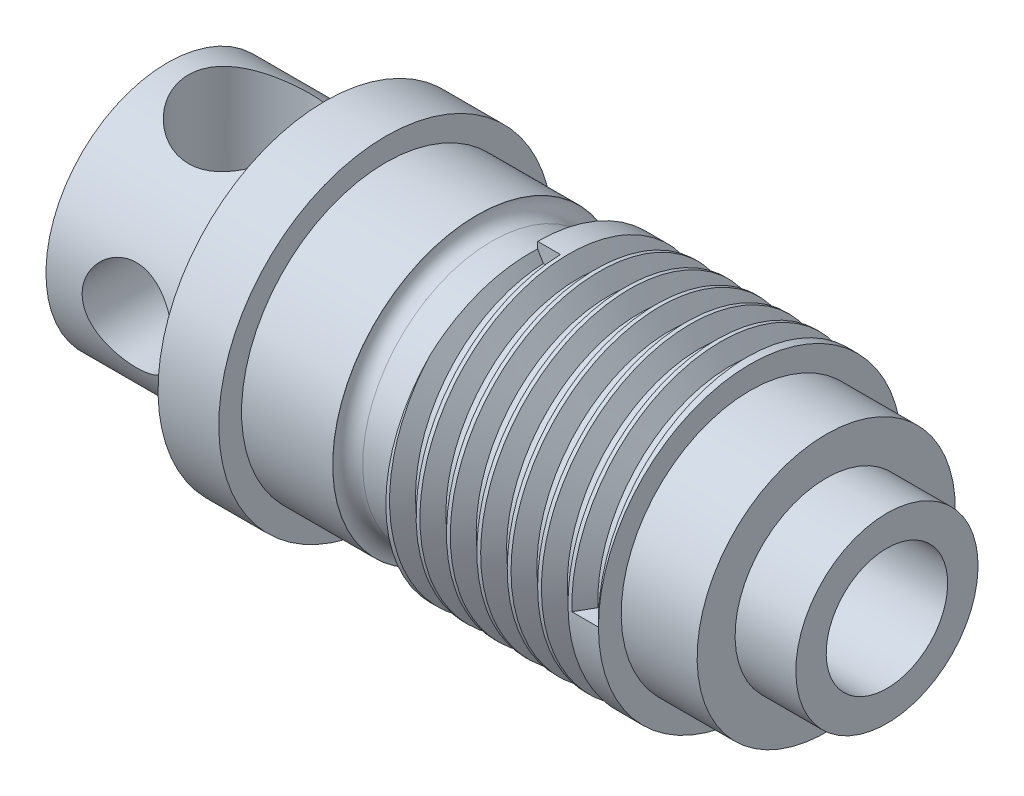
from build123d import *

# Parameters (mm, degrees)
CUT_EXTRUDE_1_DEPTH      = 16.149257408
CUT_EXTRUDE_1_DEPTH_BACK = 16.149257408
SKETCH_2_R               = 1.5
CUT_EXTRUDE_2_DEPTH      = 16.149257408
CUT_EXTRUDE_2_DEPTH_BACK = 16.149257408
SKETCH_3_R               = 2
THREAD_1_PITCH           = 1
SKETCH_6_R               = 2
CUT_EXTRUDE_3_DEPTH      = 21


with BuildPart() as part:
    # Sketch 1 → Повернуть1 (revolve)
    with BuildSketch(Plane.XY, mode=Mode.PRIVATE) as revolve_1_sk:
        with BuildLine():
            Line((13, 0), (-13, 0))
            Line((-13, 0), (-10.690598923, -4))
            Line((-10.690598923, -4), (-5.5, -4))
            Line((-5.5, -4), (-5.5, -5.5))
            Line((-5.5, -5.5), (-3.5, -5.5))
            Line((-3.5, -5.5), (-3.5, -4.75))
            Line((-3.5, -4.75), (-0.5, -4.75))
            Line((-0.5, -4.75), (-0.5, -4.74))
            ThreePointArc((-0.5, -4.74), (-0.356482323, -4.393517677), (-0.01, -4.25))
            Line((-0.01, -4.25), (1, -4.25))
            ThreePointArc((1, -4.25), (1.353553391, -4.396446609), (1.5, -4.75))
            Line((1.5, -4.75), (1.5, -5))
            Line((1.5, -5), (8.5, -5))
            Line((8.5, -5), (8.5, -4.25))
            Line((8.5, -4.25), (11, -4.25))
            Line((11, -4.25), (11, -3))
            Line((11, -3), (13, -3))
            Line((13, -3), (13, 0))
        make_face()
    revolve(revolve_1_sk.sketch.rotate(Axis((13, 0, 0), (-1, 0, 0)), 180), axis=Axis((13, 0, 0), (-1, 0, 0)))

    # Эскиз2 → Вырез-Вытянуть1 (cut, two sides: drawn at the far end of the back side and taken through both)
    with BuildSketch(Plane.XY.offset(-CUT_EXTRUDE_1_DEPTH_BACK)):
        with Locations((-8, 0)):
            Circle(SKETCH_2_R)
    extrude(amount=CUT_EXTRUDE_1_DEPTH + CUT_EXTRUDE_1_DEPTH_BACK, mode=Mode.SUBTRACT)

    # Эскиз3 → Вырез-Вытянуть2 (cut, two sides: drawn at the far end of the back side and taken through both)
    with BuildSketch(Plane(origin=(0, 0, 0), x_dir=(1, 0, 0), z_dir=(0, 1, 0)).offset(-CUT_EXTRUDE_2_DEPTH_BACK)):
        with Locations(Location((-8, 0, 0), (0, 0, 270))):
            Circle(SKETCH_3_R)
    extrude(amount=CUT_EXTRUDE_2_DEPTH + CUT_EXTRUDE_2_DEPTH_BACK, mode=Mode.SUBTRACT)

    # Резьба1: the profile of Sketch 1 2 profile screwed along a right-hand helix of 6.25 turns, 8 arcs to a turn; built about Z, then put on its axis
    thread_1_z = Axis((0, 0, 0), (0, 0, 1))
    thread_1_corners = [(5.0003, 0, -0.000173205), (5.0003, 0, 0.875173202), (4.458734125, 0, 0.562499999), (4.458734125, 0, 0.312499999)]
    with BuildLine(mode=Mode.PRIVATE) as thread_1_profile:
        Line(thread_1_corners[0], thread_1_corners[1])
        Line(thread_1_corners[1], thread_1_corners[2])
        Line(thread_1_corners[2], thread_1_corners[3])
        Line(thread_1_corners[3], thread_1_corners[0])
    thread_1_cap = Face(thread_1_profile.wire())
    thread_1_turn_angles = [0, 22.5, 45, 67.5, 90, 112.5, 135, 157.5, 180, 202.5, 225, 247.5, 270, 292.5, 315, 337.5, 360]
    thread_1_turn_weights = [1, 0.9238795325112867, 1, 0.9238795325112867, 1, 0.9238795325112867, 1, 0.9238795325112867, 1, 0.9238795325112867, 1, 0.9238795325112867, 1, 0.9238795325112867, 1, 0.9238795325112867, 1]
    thread_1_turn_rails = [Edge.make_bspline([Vector(p[0], p[1], 0).rotate(thread_1_z, thread_1_turn_angles[k]) / thread_1_turn_weights[k] + Vector(0, 0, p[2] + THREAD_1_PITCH * thread_1_turn_angles[k] / 360) for k in range(17)], [0, 0, 0, 1, 1, 2, 2, 3, 3, 4, 4, 5, 5, 6, 6, 7, 7, 8, 8, 8], 2, thread_1_turn_weights) for p in thread_1_corners]
    thread_1_turn_sides = [Face.make_surface_from_curves(thread_1_turn_rails[p[0]], thread_1_turn_rails[p[1]]) for p in [(0, 1), (1, 2), (2, 3), (3, 0)]]
    thread_1_last_angles = [2160, 2182.5, 2205, 2227.5, 2250]
    thread_1_last_weights = [1, 0.9238795325112867, 1, 0.9238795325112867, 1]
    thread_1_last_rails = [Edge.make_bspline([Vector(p[0], p[1], 0).rotate(thread_1_z, thread_1_last_angles[k]) / thread_1_last_weights[k] + Vector(0, 0, p[2] + THREAD_1_PITCH * thread_1_last_angles[k] / 360) for k in range(5)], [0, 0, 0, 1, 1, 2, 2, 2], 2, thread_1_last_weights) for p in thread_1_corners]
    thread_1_last_sides = [Face.make_surface_from_curves(thread_1_last_rails[p[0]], thread_1_last_rails[p[1]]) for p in [(0, 1), (1, 2), (2, 3), (3, 0)]]
    thread_1 = Plane(origin=(8.5, 0, 0), x_dir=(0, 0, 1), z_dir=(-1, 0, 0)) * Solid(Shell([*[p.moved(Location((0, 0, THREAD_1_PITCH * i))) for i in range(6) for p in thread_1_turn_sides], *thread_1_last_sides, thread_1_cap, thread_1_cap.rotate(thread_1_z, 2250).moved(Location((0, 0, THREAD_1_PITCH * 2250 / 360)))]))
    add(thread_1, mode=Mode.SUBTRACT)

    # Эскиз6 → Вырез-Вытянуть3 (cut)
    with BuildSketch(Plane(origin=(13, 0, 0), x_dir=(0, 0, -1), z_dir=(1, 0, 0))):
        with Locations(Location((0, 0, 0), (0, 0, 90))):
            Circle(SKETCH_6_R)
    extrude(amount=-CUT_EXTRUDE_3_DEPTH, mode=Mode.SUBTRACT)


solid = part.part
